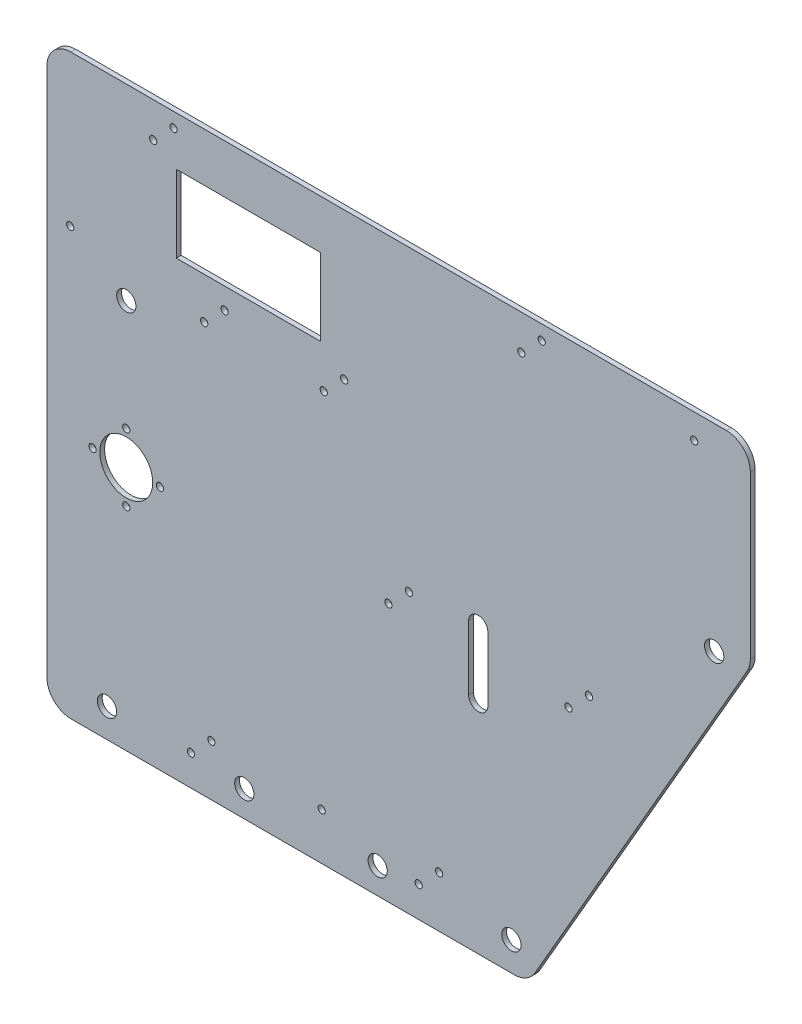
from build123d import *

# Parameters (mm, degrees)
BOSS_EXTRUDE1_DEPTH = 2
SKETCH2_R           = 4
SKETCH2_R_2         = 11
SKETCH2_R_3         = 1.5
CUT_EXTRUDE1_DEPTH  = 3
SKETCH4_W           = 292.37604307
SKETCH4_H           = 50
BOSS_EXTRUDE2_DEPTH = 2
FILLET1_R           = 10
SKETCH5_R           = 1.5
SKETCH5_W           = 60
SKETCH5_H           = 32
CUT_EXTRUDE2_DEPTH  = 11


with BuildPart() as part:
    # Sketch1 → Boss-Extrude1 (new body)
    with BuildSketch(Plane.XY):
        Polygon((-100, 110), (-100, -80), (100, -80), (192.37604307, 80), (192.37604307, 110), align=None)
    extrude(amount=BOSS_EXTRUDE1_DEPTH)

    # Sketch2 → Cut-Extrude1 (cut)
    with BuildSketch(Plane.XY.offset(2)):
        with Locations((93.07179677, -68)):
            Circle(SKETCH2_R)
        with Locations((177.364936071, 78)):
            Circle(SKETCH2_R)
        with Locations((-67, 22)):
            Circle(SKETCH2_R_2)
        with Locations((-75, -68)):
            Circle(SKETCH2_R)
        with Locations((-53, 22)):
            Circle(SKETCH2_R_3)
        with Locations((-67, 36)):
            Circle(SKETCH2_R_3)
        with Locations((-81, 22)):
            Circle(SKETCH2_R_3)
        with Locations((-67, 8)):
            Circle(SKETCH2_R_3)
        with Locations((54.54952947, -67.242640687)):
            Circle(SKETCH2_R_3)
        with Locations((63.034810844, -58.757359313)):
            Circle(SKETCH2_R_3)
        with Locations((14.225855729, -60.5)):
            Circle(SKETCH2_R_3)
        with Locations((-40.127135228, -67.242640687)):
            Circle(SKETCH2_R_3)
        with Locations((-31.641853854, -58.757359313)):
            Circle(SKETCH2_R_3)
        with Locations((-90.295627115, 97.216930167)):
            Circle(SKETCH2_R_3)
        with Locations((-34.605070088, 90.47428948)):
            Circle(SKETCH2_R_3)
        with Locations((-26.119788714, 98.959570854)):
            Circle(SKETCH2_R_3)
        with Locations((15.078196993, 90.47428948)):
            Circle(SKETCH2_R_3)
        with Locations((23.563478368, 98.959570854)):
            Circle(SKETCH2_R_3)
        with Locations((41.969500075, 27.47428948)):
            Circle(SKETCH2_R_3)
        with Locations((50.454781449, 35.959570854)):
            Circle(SKETCH2_R_3)
        with Locations((116.811272287, 27.47428948)):
            Circle(SKETCH2_R_3)
        with Locations((125.296553661, 35.959570854)):
            Circle(SKETCH2_R_3)
        with Locations((169.055759563, 149.730582757)):
            Circle(SKETCH2_R_3)
        with Locations((-55.814717647, 145.47428948)):
            Circle(SKETCH2_R_3)
        with Locations((-47.329436273, 153.959570854)):
            Circle(SKETCH2_R_3)
        with Locations((97.192431756, 145.47428948)):
            Circle(SKETCH2_R_3)
        with Locations((105.67771313, 153.959570854)):
            Circle(SKETCH2_R_3)
        with Locations((-17.947932492, -69.117445741)):
            Circle(SKETCH2_R)
        with Locations((37.494421294, -69.117445741)):
            Circle(SKETCH2_R)
        with Locations((-67, 82)):
            Circle(SKETCH2_R)
        with BuildLine():
            Line((75.290389443, 11.241781095), (75.290389443, 37.908558601))
            ThreePointArc((75.290389443, 37.908558601), (79.290389443, 41.908558601), (83.290389443, 37.908558601))
            Line((83.290389443, 37.908558601), (83.290389443, 11.241781095))
            ThreePointArc((83.290389443, 11.241781095), (79.290389443, 7.241781095), (75.290389443, 11.241781095))
        make_face()
    extrude(amount=-CUT_EXTRUDE1_DEPTH, mode=Mode.SUBTRACT)

    # Sketch4 → Boss-Extrude2 (add)
    with BuildSketch(Plane.XY.offset(2)):
        with Locations((46.188021535, 135)):
            Rectangle(SKETCH4_W, SKETCH4_H)
    extrude(amount=-BOSS_EXTRUDE2_DEPTH)

    # Fillet1
    fillet1_edges = [part.edges().sort_by_distance(p)[0] for p in [
        (192.37604307, 160, 1),
        (192.37604307, 80, 1),
        (100, -80, 1),
        (-100, -80, 1),
        (-100, 160, 1),
    ]]
    fillet(fillet1_edges, radius=FILLET1_R)

    # Sketch5 → Cut-Extrude2 (cut)
    with BuildSketch(Plane.XY.offset(2)):
        with Locations((-55.814717647, 145.47428948)):
            Circle(SKETCH5_R)
        with Locations((-47.329436273, 153.959570854)):
            Circle(SKETCH5_R)
        with Locations((97.192431756, 145.47428948)):
            Circle(SKETCH5_R)
        with Locations((105.67771313, 153.959570854)):
            Circle(SKETCH5_R)
        with Locations((169.055759563, 149.730582757)):
            Circle(SKETCH5_R)
        with Locations((-16.178132997, 123.716930167)):
            Rectangle(SKETCH5_W, SKETCH5_H)
    extrude(amount=-CUT_EXTRUDE2_DEPTH, mode=Mode.SUBTRACT)


solid = part.part
